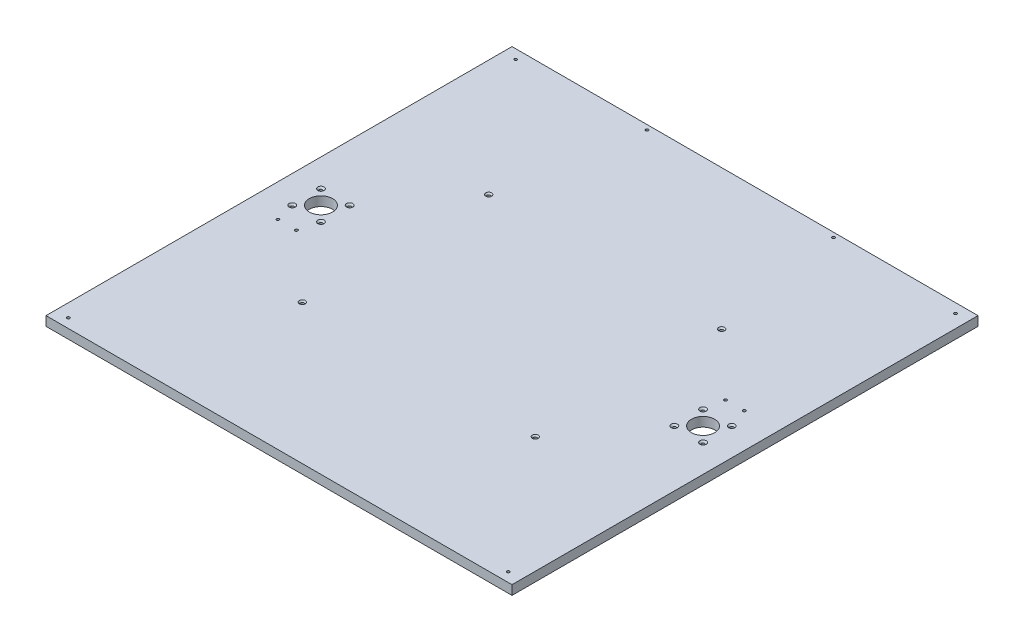
from build123d import *

# Parameters (mm, degrees)
SZKIC1_W                                             = 500
SZKIC1_H                                             = 500
DODANIE_WYCI_GNI_CIE1_DEPTH                          = 10
SZKIC2_R                                             = 12.5
WYTNIJ_WYCI_GNI_CIE1_DEPTH                           = 708.177488329
POG_BIENIE_STO_KOWE_POD_M3_WKR_T_USTALAJ_D           = 3.4
POG_BIENIE_STO_KOWE_POD_M3_WKR_T_USTALAJ_CSINK_D     = 6.72
POG_BIENIE_STO_KOWE_POD_M3_WKR_T_USTALAJ_CSINK_ANGLE = 90
POG_BIENIE_STO_KOWE_POD_M3_WKR_T_DO_CZ_C_D           = 3.4
POG_BIENIE_STO_KOWE_POD_M3_WKR_T_DO_CZ_C_DEPTH       = 10
POG_BIENIE_STO_KOWE_POD_M3_WKR_T_DO_CZ_C_CSINK_D     = 6.3
POG_BIENIE_STO_KOWE_POD_M3_WKR_T_DO_CZ_C_CSINK_ANGLE = 90
POG_BIENIE_STO_KOWE_POD_M3_WKR_T_DO_CZ_C_TIP         = 1.021463052
OTWORY_USTALAJ_CE_3_0MM1_D                           = 3
OTWORY_USTALAJ_CE_3_0MM1_DEPTH                       = 10
OTWORY_USTALAJ_CE_3_0MM1_TIP                         = 0.901290929
OTWORY_USTALAJ_CE_3_0MM2_D                           = 3
OTWORY_USTALAJ_CE_3_0MM2_DEPTH                       = 10
OTWORY_USTALAJ_CE_3_0MM2_TIP                         = 0.901290929
F_3_0MM_DOWEL_HOLE1_D                                = 3


with BuildPart() as part:
    # Szkic1 → Dodanie-wyciągnięcie1 (new body)
    with BuildSketch(Plane(origin=(0, 0, 0), x_dir=(1, 0, 0), z_dir=(0, 1, 0))):
        with Locations((250, 250)):
            Rectangle(SZKIC1_W, SZKIC1_H)
    extrude(amount=DODANIE_WYCI_GNI_CIE1_DEPTH)

    # Szkic2 → Wytnij-wyciągnięcie1 (cut, through all)
    with BuildSketch(Plane(origin=(0, 10, 0), x_dir=(1, 0, 0), z_dir=(0, 1, 0))):
        with Locations((45, 250)):
            Circle(SZKIC2_R)
        with Locations((455, 250)):
            Circle(SZKIC2_R)
    extrude(amount=-WYTNIJ_WYCI_GNI_CIE1_DEPTH, mode=Mode.SUBTRACT)

    # Pogłębienie stożkowe pod M3 Wkręt ustalający1 (through all)
    with Locations(Plane(origin=(0, 10, 0), x_dir=(1, 0, 0), z_dir=(0, 1, 0))):
        with Locations((439.6, 265.4), (439.6, 234.6), (470.4, 234.6), (470.4, 265.4), (60.4, 234.6), (60.4, 265.4), (29.6, 234.6), (29.6, 265.4)):
            CounterSinkHole(POG_BIENIE_STO_KOWE_POD_M3_WKR_T_USTALAJ_D / 2, POG_BIENIE_STO_KOWE_POD_M3_WKR_T_USTALAJ_CSINK_D / 2, counter_sink_angle=POG_BIENIE_STO_KOWE_POD_M3_WKR_T_USTALAJ_CSINK_ANGLE)

    # Pogłębienie stożkowe pod M3 wkręt do części metalowych z łbem soczewkowym1
    with Locations(Plane(origin=(0, 10, 0), x_dir=(1, 0, 0), z_dir=(0, 1, 0))):
        with Locations((375, 350), (375, 150), (125, 350), (125, 150)):
            CounterSinkHole(POG_BIENIE_STO_KOWE_POD_M3_WKR_T_DO_CZ_C_D / 2, POG_BIENIE_STO_KOWE_POD_M3_WKR_T_DO_CZ_C_CSINK_D / 2, depth=POG_BIENIE_STO_KOWE_POD_M3_WKR_T_DO_CZ_C_DEPTH, counter_sink_angle=POG_BIENIE_STO_KOWE_POD_M3_WKR_T_DO_CZ_C_CSINK_ANGLE)
            with Locations((0, 0, -(POG_BIENIE_STO_KOWE_POD_M3_WKR_T_DO_CZ_C_DEPTH + POG_BIENIE_STO_KOWE_POD_M3_WKR_T_DO_CZ_C_TIP / 2))):  # 118° drill point
                Cone(0, POG_BIENIE_STO_KOWE_POD_M3_WKR_T_DO_CZ_C_D / 2, POG_BIENIE_STO_KOWE_POD_M3_WKR_T_DO_CZ_C_TIP, mode=Mode.SUBTRACT)

    # Otwory ustalające Ø3.0mm1
    with Locations(Plane(origin=(0, 0, 0), x_dir=(-1, 0, 0), z_dir=(0, -1, 0))):
        with Locations((-486, 490), (-486, 10), (-14, 10), (-14, 490)):
            Hole(OTWORY_USTALAJ_CE_3_0MM1_D / 2, depth=OTWORY_USTALAJ_CE_3_0MM1_DEPTH)
            with Locations((0, 0, -(OTWORY_USTALAJ_CE_3_0MM1_DEPTH + OTWORY_USTALAJ_CE_3_0MM1_TIP / 2))):  # 118° drill point
                Cone(0, OTWORY_USTALAJ_CE_3_0MM1_D / 2, OTWORY_USTALAJ_CE_3_0MM1_TIP, mode=Mode.SUBTRACT)

    # Otwory ustalające Ø3.0mm2
    with Locations(Plane(origin=(0, 0, 0), x_dir=(-1, 0, 0), z_dir=(0, -1, 0))):
        with Locations((-150, 495), (-350, 495)):
            Hole(OTWORY_USTALAJ_CE_3_0MM2_D / 2, depth=OTWORY_USTALAJ_CE_3_0MM2_DEPTH)
            with Locations((0, 0, -(OTWORY_USTALAJ_CE_3_0MM2_DEPTH + OTWORY_USTALAJ_CE_3_0MM2_TIP / 2))):  # 118° drill point
                Cone(0, OTWORY_USTALAJ_CE_3_0MM2_D / 2, OTWORY_USTALAJ_CE_3_0MM2_TIP, mode=Mode.SUBTRACT)

    # Ø3.0mm Dowel Hole1 (through all)
    with Locations(Plane(origin=(0, 10, 0), x_dir=(1, 0, 0), z_dir=(0, 1, 0))):
        with Locations((442.985385227, 286.253048327), (462.985385227, 286.253048327), (55, 213.746951673), (35, 213.746951673)):
            Hole(F_3_0MM_DOWEL_HOLE1_D / 2)


solid = part.part
